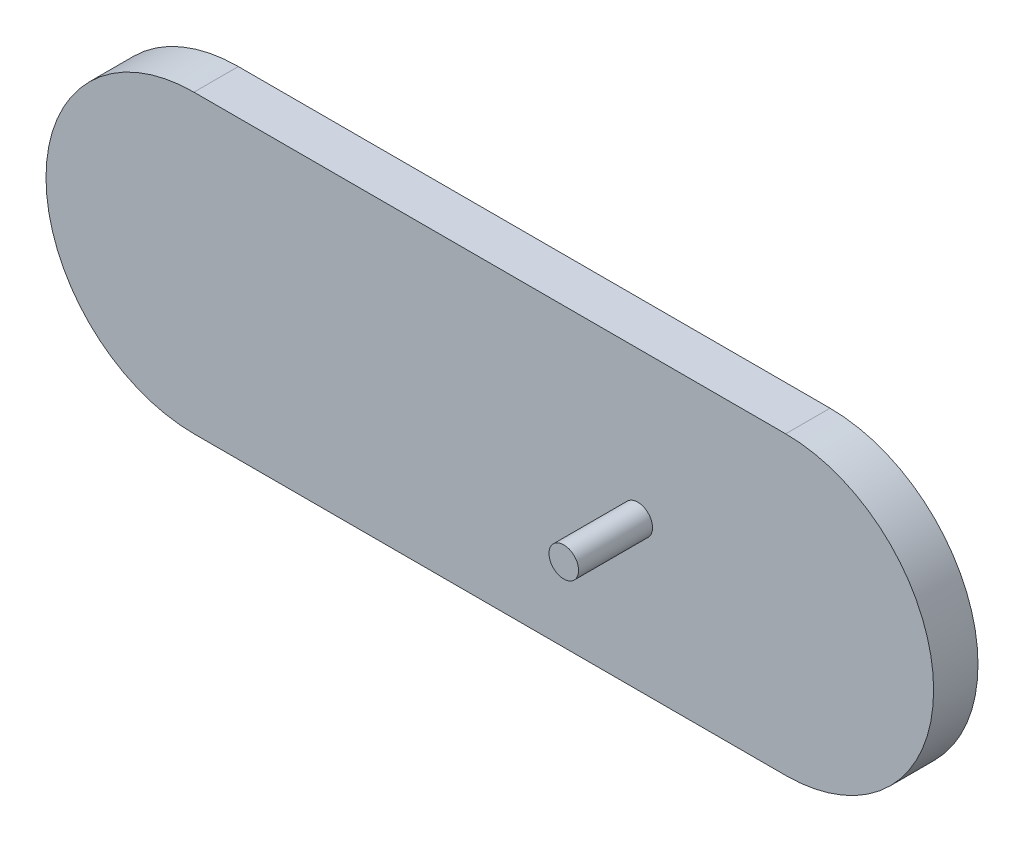
from build123d import *

# Parameters (mm, degrees)
SKETCH_1_W      = 200
SKETCH_1_H      = 100
EXTRUDE_1_DEPTH = 15
EXTRUDE_4_DEPTH = 15
SKETCH_1_16_R   = 5
EXTRUDE_6_DEPTH = 40


with BuildPart() as part:
    # 草图1 → 凸台-拉伸1 (new body)
    with BuildSketch(Plane.XY):
        with Locations((-100, 50)):
            Rectangle(SKETCH_1_W, SKETCH_1_H)
    extrude(amount=EXTRUDE_1_DEPTH)

    # 草图1<10> → 凸台-拉伸4 (add)
    with BuildSketch(Plane.XY):
        with BuildLine():
            ThreePointArc((0, 0), (50, 50), (0, 100))
            Line((0, 100), (0, 0))
        make_face()
        with BuildLine():
            ThreePointArc((-200, 100), (-250, 50), (-200, 0))
            Line((-200, 0), (-200, 100))
        make_face()
    extrude(amount=EXTRUDE_4_DEPTH)

    # 草图1<16> → 凸台-拉伸6 (add)
    with BuildSketch(Plane.XY):
        with Locations((-50, 50)):
            Circle(SKETCH_1_16_R)
    extrude(amount=EXTRUDE_6_DEPTH)


solid = part.part
